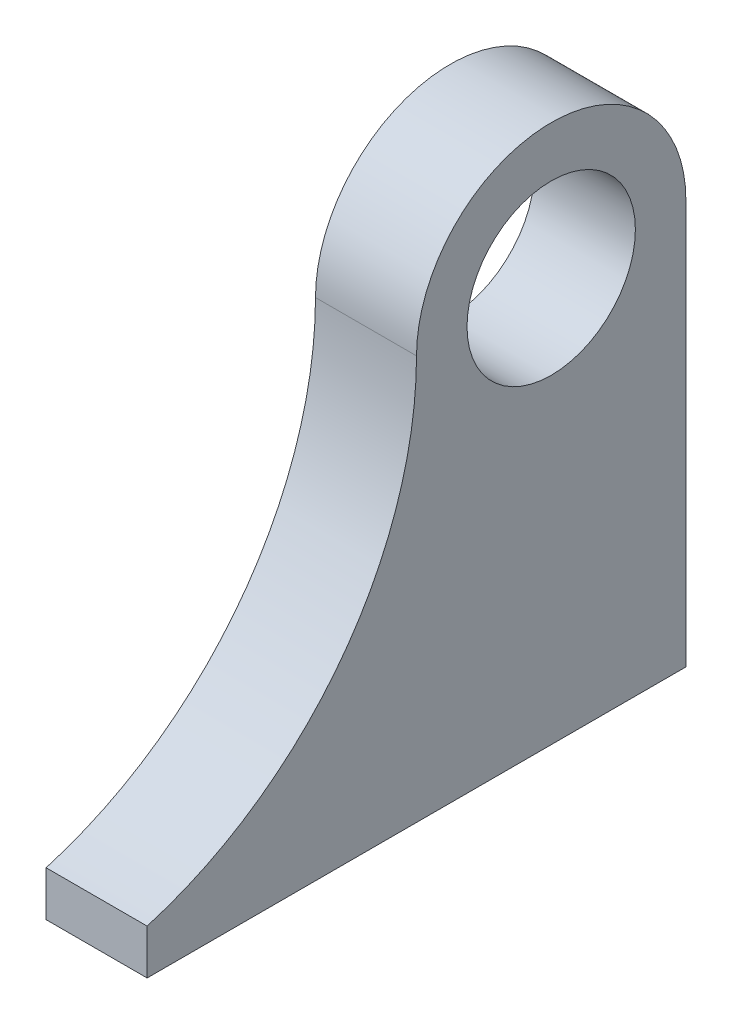
from build123d import *

# Parameters (mm, degrees)
CROQUIS1_W              = 4.7625
CROQUIS1_H              = 42.333333333
SALIENTE_EXTRUIR1_DEPTH = 25.4
CROQUIS2_R              = 3.96875
CORTAR_EXTRUIR1_DEPTH   = 25.4


with BuildPart() as part:
    # Croquis1 → Saliente-Extruir1 (new body)
    with BuildSketch(Plane(origin=(0, 0, 0), x_dir=(1, 0, 0), z_dir=(0, 1, 0))):
        with Locations((604.572916667, 432.985333334)):
            Rectangle(CROQUIS1_W, CROQUIS1_H)
    extrude(amount=SALIENTE_EXTRUIR1_DEPTH)

    # Croquis2 → Cortar-Extruir1 (cut)
    with BuildSketch(Plane(origin=(606.954166667, 0, 0), x_dir=(0, 0, -1), z_dir=(1, 0, 0))):
        with BuildLine():
            ThreePointArc((432.985333333, 25.4), (437.475461394, 23.540128061), (439.335333333, 19.05))
            Line((439.335333333, 19.05), (439.335333333, 0))
            Line((439.335333333, 0), (454.152, 0))
            Line((454.152, 0), (454.152, 25.4))
            Line((454.152, 25.4), (432.985333333, 25.4))
        make_face()
        with BuildLine():
            ThreePointArc((426.635333333, 19.05), (428.495205273, 23.540128061), (432.985333333, 25.4))
            Line((432.985333333, 25.4), (411.818666667, 25.4))
            Line((411.818666667, 25.4), (411.818666667, 0))
            Line((411.818666667, 0), (413.935333333, 0))
            Line((413.935333333, 0), (413.935333333, 2.12))
            ThreePointArc((413.935333333, 2.12), (423.10744442, 8.467999953), (426.635333333, 19.05))
        make_face()
        with Locations((432.985333333, 19.05)):
            Circle(CROQUIS2_R)
    extrude(amount=-CORTAR_EXTRUIR1_DEPTH, mode=Mode.SUBTRACT)


solid = part.part
